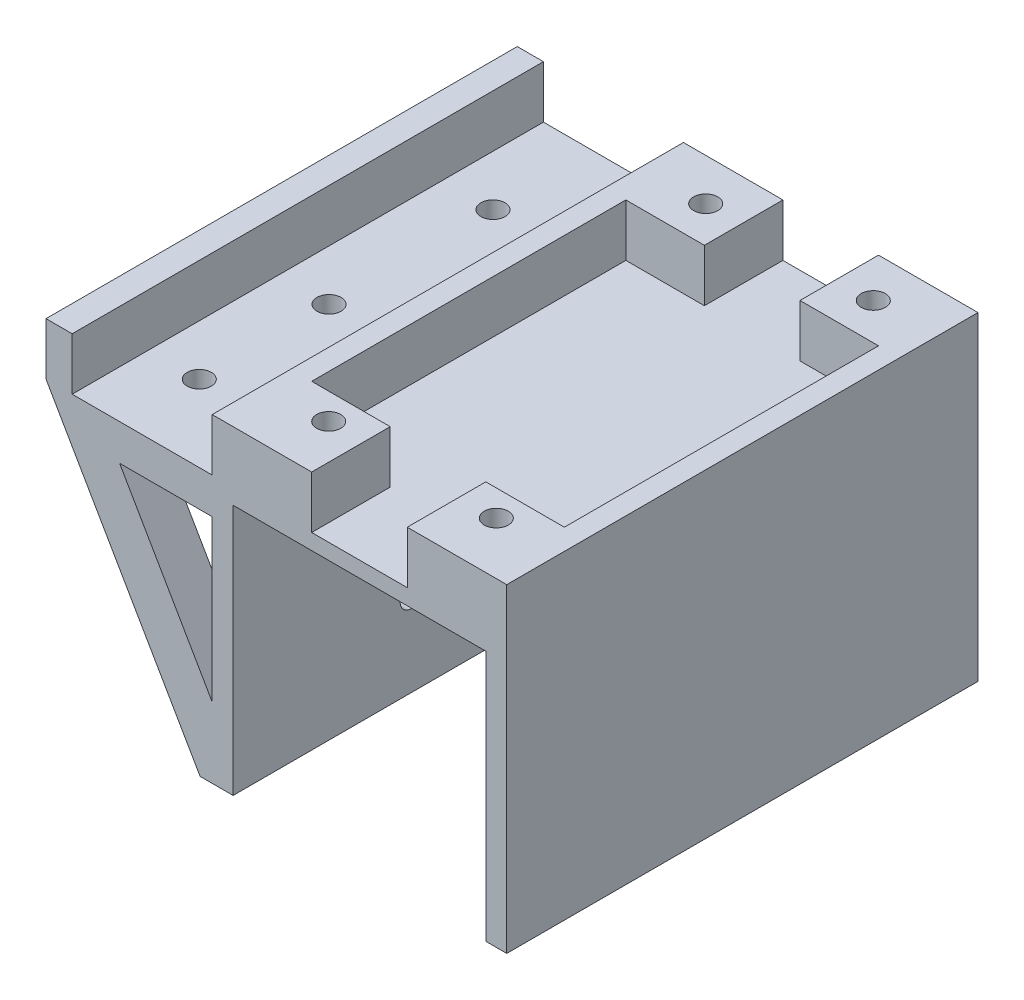
from build123d import *

# Parameters (mm, degrees)
SKETCH1_W            = 48.254
SKETCH1_H            = 10
BOSS_EXTRUDE1_DEPTH  = 70
BOSS_EXTRUDE3_DEPTH  = 8
BOSS_EXTRUDE4_DEPTH  = 8
BOSS_EXTRUDE5_DEPTH  = 8
BOSS_EXTRUDE6_DEPTH  = 70
SKETCH7_W            = 40.394634483
SKETCH7_H            = 17
CUT_EXTRUDE3_DEPTH   = 70
BOSS_EXTRUDE7_DEPTH  = 70
BOSS_EXTRUDE10_DEPTH = 8
BOSS_EXTRUDE11_DEPTH = 70
SKETCH13_W           = 83.001411072
SKETCH13_H           = 87.868559997
CUT_EXTRUDE4_DEPTH   = 4
SKETCH14_W           = 48.254
SKETCH14_H           = 10
BOSS_EXTRUDE12_DEPTH = 20
SKETCH16_W           = 56.254
SKETCH16_H           = 5
CUT_EXTRUDE5_DEPTH   = 100
SKETCH17_W           = 15
SKETCH17_H           = 15
BOSS_EXTRUDE14_DEPTH = 13
CUT_EXTRUDE8_DEPTH   = 5
SKETCH21_R           = 2.3
CUT_EXTRUDE9_DEPTH   = 15
SKETCH23_W           = 12
SKETCH23_H           = 40.530858039
CUT_EXTRUDE10_DEPTH  = 9
SKETCH25_R           = 2.3
CUT_EXTRUDE11_DEPTH  = 20
SKETCH26_R           = 2.3
CUT_EXTRUDE12_DEPTH  = 20
BOSS_EXTRUDE16_DEPTH = 20
SKETCH28_W           = 15
SKETCH28_H           = 15
BOSS_EXTRUDE17_DEPTH = 10
SKETCH29_R           = 2.3
CUT_EXTRUDE13_DEPTH  = 20
SKETCH30_W           = 10.391026801
SKETCH30_H           = 12
BOSS_EXTRUDE18_DEPTH = 5
SKETCH31_R           = 2.3
CUT_EXTRUDE14_DEPTH  = 45
SKETCH41_W           = 5
SKETCH41_H           = 90
BOSS_EXTRUDE19_DEPTH = 10
CUT_EXTRUDE15_DEPTH  = 5
SKETCH43_R           = 2.1
CUT_EXTRUDE16_DEPTH  = 5
SKETCH44_R           = 2.1
CUT_EXTRUDE17_DEPTH  = 5
SKETCH45_R           = 2.1
CUT_EXTRUDE18_DEPTH  = 5


with BuildPart() as part:
    # Sketch1 → Boss-Extrude1 (new body)
    with BuildSketch(Plane.XY):
        Polygon((0, 70), (0, 0), (4, 0), (4, 52), (52.254, 52), (52.254, 0), (56.254, 0), (56.254, 70), align=None)
        with Locations((28.127, 60)):
            Rectangle(SKETCH1_W, SKETCH1_H, mode=Mode.SUBTRACT)
    extrude(amount=BOSS_EXTRUDE1_DEPTH)

    # Sketch3 → Boss-Extrude3 (add)
    with BuildSketch(Plane.XY.offset(70)):
        Polygon((0, 62.5), (0, 70), (-40.394634483, 70), (0, 0.034440722), (0, 17.466679003), (-26, 62.5), align=None)
    extrude(amount=-BOSS_EXTRUDE3_DEPTH)

    # Sketch4 → Boss-Extrude4 (add)
    with BuildSketch(Plane(origin=(0, 0, 0), x_dir=(-1, 0, 0), z_dir=(0, 0, -1))):
        Polygon((0, 70), (40.394634483, 70), (0, 0), (0, 17.466679003), (26, 62.5), (0, 62.5), align=None)
    extrude(amount=-BOSS_EXTRUDE4_DEPTH)

    # Sketch5 → Boss-Extrude5 (add)
    with BuildSketch(Plane(origin=(0, 0, 39), x_dir=(-1, 0, 0), z_dir=(0, 0, -1))):
        Polygon((0, 62.5), (0, 70), (40.394634483, 70), (0, 0), (0, 17.466679003), (26, 62.5), align=None)
    extrude(amount=BOSS_EXTRUDE5_DEPTH)

    # Sketch6 → Boss-Extrude6 (add)
    with BuildSketch(Plane(origin=(0, 0, 0), x_dir=(-1, 0, 0), z_dir=(0, 0, -1))):
        Polygon((0, 62.5), (36.066637932, 62.5), (40.394634483, 70), (0, 70), align=None)
        Polygon((-4, 0), (0, 0), (7.50186069, 13), (-4, 13), align=None)
    extrude(amount=-BOSS_EXTRUDE6_DEPTH)

    # Sketch7 → Cut-Extrude3 (cut)
    with BuildSketch(Plane.XY.offset(70)):
        with Locations((-20.197317242, 61.5)):
            Rectangle(SKETCH7_W, SKETCH7_H)
    extrude(amount=-CUT_EXTRUDE3_DEPTH, mode=Mode.SUBTRACT)

    # Sketch8 → Boss-Extrude7 (add)
    with BuildSketch(Plane(origin=(0, 0, 0), x_dir=(-1, 0, 0), z_dir=(0, 0, -1))):
        Polygon((-4, 55), (-4, 52), (30.007442759, 52), (31.73864138, 55), align=None)
    extrude(amount=-BOSS_EXTRUDE7_DEPTH)

    # Sketch11 → Boss-Extrude10 (add)
    with BuildSketch(Plane.XY.offset(70)):
        Polygon((-31.73864138, 55), (0, 0), (-3.053687451, 13), (-27.288965695, 55), align=None)
    extrude(amount=-BOSS_EXTRUDE10_DEPTH)

    # Sketch12 → Boss-Extrude11 (add)
    with BuildSketch(Plane.XY.offset(70)):
        Polygon((-31.73864138, 55), (-27.75981023, 48.105069917), (0, 48.105069917), (0, 55), align=None)
    extrude(amount=-BOSS_EXTRUDE11_DEPTH)

    # Sketch13 → Cut-Extrude4 (cut)
    with BuildSketch(Plane.XZ):
        with Locations((25.938658228, 33.313825886)):
            Rectangle(SKETCH13_W, SKETCH13_H)
    extrude(amount=-CUT_EXTRUDE4_DEPTH, mode=Mode.SUBTRACT)

    # Sketch14 → Boss-Extrude12 (add)
    with BuildSketch(Plane.XY.offset(70)):
        Polygon((-2.308264828, 4), (-31.73864138, 55), (0, 55), (0, 70), (56.254, 70), (56.254, 4), (52.254, 4), (52.254, 52), (4, 52), (4, 4), align=None)
        Polygon((-17.689083241, 48.105069917), (0, 48.105069917), (0, 17.466679003), align=None, mode=Mode.SUBTRACT)
        with Locations((28.127, 60)):
            Rectangle(SKETCH14_W, SKETCH14_H, mode=Mode.SUBTRACT)
    extrude(amount=BOSS_EXTRUDE12_DEPTH)

    # Sketch16 → Cut-Extrude5 (cut)
    with BuildSketch(Plane.XY.offset(90)):
        with Locations((28.127, 67.5)):
            Rectangle(SKETCH16_W, SKETCH16_H)
    extrude(amount=-CUT_EXTRUDE5_DEPTH, mode=Mode.SUBTRACT)

    # Sketch17 → Boss-Extrude14 (add)
    with BuildSketch(Plane(origin=(0, 65, 0), x_dir=(1, 0, 0), z_dir=(0, 1, 0))):
        with Locations((44.754, -7.5)):
            Rectangle(SKETCH17_W, SKETCH17_H)
        with Locations((44.754, -82.5)):
            Rectangle(SKETCH17_W, SKETCH17_H)
    extrude(amount=-BOSS_EXTRUDE14_DEPTH)

    # Sketch22 → Cut-Extrude8 (cut)
    with BuildSketch(Plane.XZ.offset(-52)):
        Polygon((48.096455918, 6.003620146), (47.904143628, 10.329474511), (44.06168771, 12.325854365), (40.411544082, 9.996379854), (40.603856372, 5.670525489), (44.44631229, 3.674145635), align=None)
        Polygon((45.200685086, 75.774625774), (48.386623963, 78.707166221), (47.439938877, 82.932540447), (43.307314914, 84.225374226), (40.121376037, 81.292833779), (41.068061123, 77.067459553), align=None)
    extrude(amount=-CUT_EXTRUDE8_DEPTH, mode=Mode.SUBTRACT)

    # Sketch21 → Cut-Extrude9 (cut)
    with BuildSketch(Plane(origin=(0, 52, 0), x_dir=(-1, 0, 0), z_dir=(0, -1, 0))):
        with Locations((-44.254, -80)):
            Circle(SKETCH21_R)
        with Locations((-44.254, -8)):
            Circle(SKETCH21_R)
    extrude(amount=-CUT_EXTRUDE9_DEPTH, mode=Mode.SUBTRACT)

    # Sketch23 → Cut-Extrude10 (cut)
    with BuildSketch(Plane(origin=(0, 0, 0), x_dir=(0, 0, 1), z_dir=(-0.8661319205837115, -0.49981546209173167, 0))):
        with Locations((76, 35.274689955)):
            Rectangle(SKETCH23_W, SKETCH23_H)
    extrude(amount=-CUT_EXTRUDE10_DEPTH, mode=Mode.SUBTRACT)

    # Sketch25 → Cut-Extrude11 (cut)
    with BuildSketch(Plane(origin=(0, 48.105069917, 0), x_dir=(-1, 0, 0), z_dir=(0, -1, 0))):
        with Locations((17.075514089, -19.30064897)):
            Circle(SKETCH25_R)
        with Locations((17.075514089, -50.613733273)):
            Circle(SKETCH25_R)
    extrude(amount=-CUT_EXTRUDE11_DEPTH, mode=Mode.SUBTRACT)

    # Sketch26 → Cut-Extrude12 (cut)
    with BuildSketch(Plane.XZ.offset(-48.105069917)):
        with Locations((-17.075514089, 75.391336138)):
            Circle(SKETCH26_R)
    extrude(amount=-CUT_EXTRUDE12_DEPTH, mode=Mode.SUBTRACT)

    # Sketch27 → Boss-Extrude16 (add)
    with BuildSketch(Plane.XY.offset(90)):
        Polygon((-23.310381194, 48.105069917), (-27.75981023, 48.105069917), (-31.73864138, 55), (-23.310381194, 55), align=None)
    extrude(amount=-BOSS_EXTRUDE16_DEPTH)

    # Sketch28 → Boss-Extrude17 (add)
    with BuildSketch(Plane(origin=(0, 55, 0), x_dir=(1, 0, 0), z_dir=(0, 1, 0))):
        with Locations((11.5, -7.5)):
            Rectangle(SKETCH28_W, SKETCH28_H)
        with Locations((11.5, -82.5)):
            Rectangle(SKETCH28_W, SKETCH28_H)
    extrude(amount=BOSS_EXTRUDE17_DEPTH)

    # Sketch29 → Cut-Extrude13 (cut)
    with BuildSketch(Plane(origin=(0, 52, 0), x_dir=(-1, 0, 0), z_dir=(0, -1, 0))):
        with Locations((-12.254, -8)):
            Circle(SKETCH29_R)
        with Locations((-12.254, -80)):
            Circle(SKETCH29_R)
    extrude(amount=-CUT_EXTRUDE13_DEPTH, mode=Mode.SUBTRACT)

    # Sketch30 → Boss-Extrude18 (add)
    with BuildSketch(Plane.XZ.offset(-48.105069917)):
        with Locations((-22.56429683, 76)):
            Rectangle(SKETCH30_W, SKETCH30_H)
    extrude(amount=-BOSS_EXTRUDE18_DEPTH)

    # Sketch31 → Cut-Extrude14 (cut)
    with BuildSketch(Plane.XZ.offset(-48.105069917)):
        with Locations((-17.075514089, 75.391336138)):
            Circle(SKETCH31_R)
    extrude(amount=-CUT_EXTRUDE14_DEPTH, mode=Mode.SUBTRACT)

    # Sketch41 → Boss-Extrude19 (add)
    with BuildSketch(Plane(origin=(0, 55, 0), x_dir=(1, 0, 0), z_dir=(0, 1, 0))):
        with Locations((-29.23864138, -45)):
            Rectangle(SKETCH41_W, SKETCH41_H)
    extrude(amount=BOSS_EXTRUDE19_DEPTH)

    # Sketch42 → Cut-Extrude15 (cut)
    with BuildSketch(Plane.XZ.offset(-52)):
        Polygon((14.151605853, 76.107816548), (16.573532672, 79.697283149), (14.675926819, 83.589466601), (10.356394147, 83.892183452), (7.934467328, 80.302716851), (9.832073181, 76.410533399), align=None)
        Polygon((13.818929946, 3.96255102), (16.532998356, 7.336544599), (14.96806841, 11.373993579), (10.689070054, 12.03744898), (7.975001644, 8.663455401), (9.53993159, 4.626006421), align=None)
    extrude(amount=-CUT_EXTRUDE15_DEPTH, mode=Mode.SUBTRACT)

    # Sketch43 → Cut-Extrude16 (cut)
    with BuildSketch(Plane(origin=(4, 0, 0), x_dir=(0, 0, -1), z_dir=(1, 0, 0))):
        with Locations((-56, 36)):
            Circle(SKETCH43_R)
    extrude(amount=-CUT_EXTRUDE16_DEPTH, mode=Mode.SUBTRACT)

    # Sketch44 → Cut-Extrude17 (cut)
    with BuildSketch(Plane(origin=(4, 0, 0), x_dir=(0, 0, -1), z_dir=(1, 0, 0))):
        with Locations((-56, 20)):
            Circle(SKETCH44_R)
        with Locations((-16, 20)):
            Circle(SKETCH44_R)
    extrude(amount=-CUT_EXTRUDE17_DEPTH, mode=Mode.SUBTRACT)

    # Sketch45 → Cut-Extrude18 (cut)
    with BuildSketch(Plane.ZY):
        with Locations((16, 36)):
            Circle(SKETCH45_R)
    extrude(amount=-CUT_EXTRUDE18_DEPTH, mode=Mode.SUBTRACT)


solid = part.part
